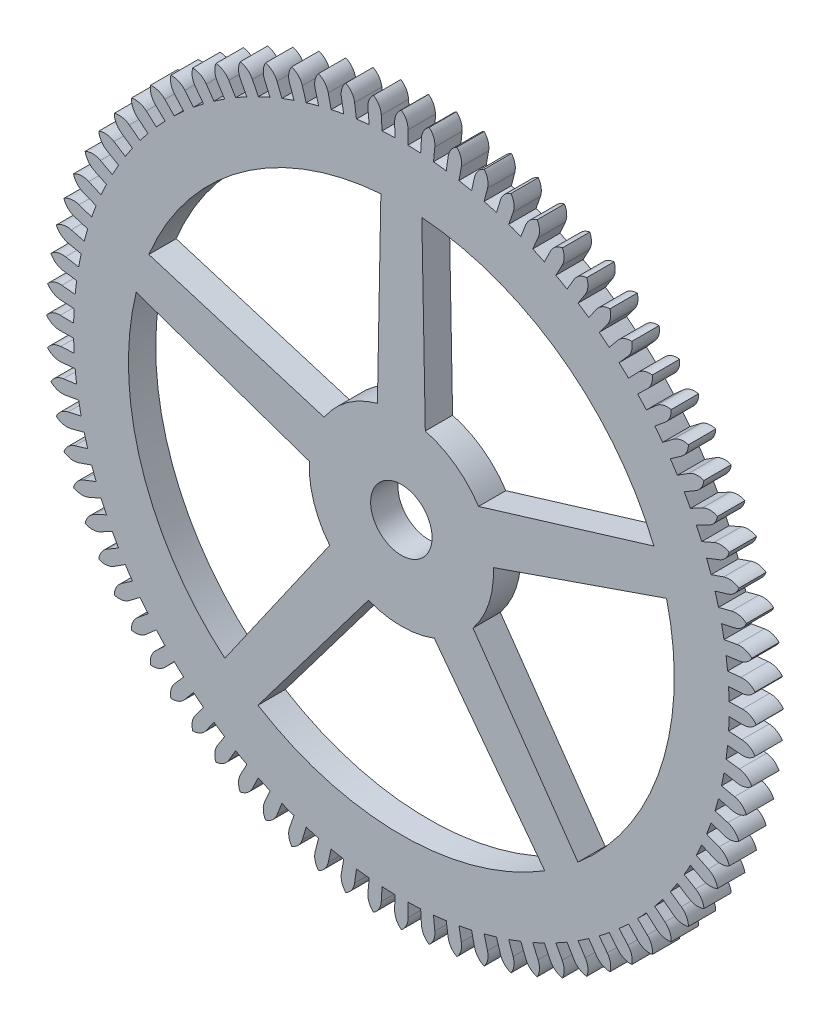
from build123d import *

# Parameters (mm, degrees)
SKETCH1_R           = 0.9
BOSS_EXTRUDE1_DEPTH = 0.8


with BuildPart() as part:
    # Sketch1 → Boss-Extrude1 (new body)
    with BuildSketch(Plane.XY):
        with BuildLine():
            ThreePointArc((0.196340537, 9.998072334), (0.146742853, 10.223513802), (0, 10.4017))
            ThreePointArc((0, 10.4017), (-0.146742853, 10.223513802), (-0.196340537, 9.998072334))
            Line((-0.196340537, 9.998072334), (-0.188630244, 9.605448033))
            ThreePointArc((-0.188630244, 9.605448033), (-0.377180828, 9.59989312), (-0.565586006, 9.590637401))
            Line((-0.565586006, 9.590637401), (-0.588704429, 9.982656315))
            ThreePointArc((-0.588704429, 9.982656315), (-0.655837154, 10.203511433), (-0.816107976, 10.36963503))
            ThreePointArc((-0.816107976, 10.36963503), (-0.948418142, 10.18048481), (-0.980174999, 9.951846913))
            Line((-0.980174999, 9.951846913), (-0.941683527, 9.561037884))
            ThreePointArc((-0.941683527, 9.561037884), (-1.129217039, 9.540706587), (-1.316315231, 9.5166973))
            Line((-1.316315231, 9.5166973), (-1.370119837, 9.9056939))
            ThreePointArc((-1.370119837, 9.9056939), (-1.454373707, 10.120601022), (-1.627184375, 10.273637812))
            ThreePointArc((-1.627184375, 10.273637812), (-1.744246118, 10.074689743), (-1.757966357, 9.844265046))
            Line((-1.757966357, 9.844265046), (-1.688931018, 9.457680757))
            ThreePointArc((-1.688931018, 9.457680757), (-1.874291251, 9.422698424), (-2.058928935, 9.384083596))
            Line((-2.058928935, 9.384083596), (-2.143088001, 9.767659588))
            ThreePointArc((-2.143088001, 9.767659588), (-2.243943563, 9.975293741), (-2.428228641, 10.114300201))
            ThreePointArc((-2.428228641, 10.114300201), (-2.529320236, 9.906780863), (-2.524919267, 9.675990011))
            Line((-2.524919267, 9.675990011), (-2.425765687, 9.296013883))
            ThreePointArc((-2.425765687, 9.296013883), (-2.607809834, 9.246596193), (-2.788848658, 9.193613895))
            Line((-2.788848658, 9.193613895), (-2.902843315, 9.569404406))
            ThreePointArc((-2.902843315, 9.569404406), (-3.01967876, 9.768485457), (-3.21430207, 9.892604566))
            ThreePointArc((-3.21430207, 9.892604566), (-3.298800254, 9.677793386), (-3.27630521, 9.448059281))
            Line((-3.27630521, 9.448059281), (-3.147644704, 9.077033993))
            ThreePointArc((-3.147644704, 9.077033993), (-3.325250402, 9.013485622), (-3.501574201, 8.946462508))
            Line((-3.501574201, 8.946462508), (-3.644701634, 9.312150665))
            ThreePointArc((-3.644701634, 9.312150665), (-3.776796634, 9.501451211), (-3.980558258, 9.609917733))
            ThreePointArc((-3.980558258, 9.609917733), (-4.047942072, 9.389139094), (-4.007491642, 9.161878123))
            Line((-4.007491642, 9.161878123), (-3.850117445, 8.802091169))
            ThreePointArc((-3.850117445, 8.802091169), (-4.022189696, 8.724803914), (-4.192711374, 8.644153204))
            Line((-4.192711374, 8.644153204), (-4.364089156, 8.997484417))
            ThreePointArc((-4.364089156, 8.997484417), (-4.510629301, 9.175837359), (-4.722272981, 9.267982563))
            ThreePointArc((-4.722272981, 9.267982563), (-4.77212698, 9.042597637), (-4.713970555, 8.81921094))
            Line((-4.713970555, 8.81921094), (-4.528852931, 8.472880527))
            ThreePointArc((-4.528852931, 8.472880527), (-4.694330853, 8.382330889), (-4.857999088, 8.288549822))
            Line((-4.857999088, 8.288549822), (-5.056570616, 8.627345687))
            ThreePointArc((-5.056570616, 8.627345687), (-5.216652438, 8.793651419), (-5.434873321, 8.868907198))
            ThreePointArc((-5.434873321, 8.868907198), (-5.466890139, 8.640305559), (-5.391386272, 8.422170389))
            Line((-5.391386272, 8.422170389), (-5.179666533, 8.091431758))
            ThreePointArc((-5.179666533, 8.091431758), (-5.3375299, 7.988178006), (-5.493335622, 7.881844773))
            Line((-5.493335622, 7.881844773), (-5.717876638, 8.204016501))
            ThreePointArc((-5.717876638, 8.204016501), (-5.890513178, 8.357249694), (-6.113965859, 8.41515207))
            ThreePointArc((-6.113965859, 8.41515207), (-6.127948102, 8.184743123), (-6.035562301, 7.973204357))
            Line((-6.035562301, 7.973204357), (-5.798545769, 7.660096622))
            ThreePointArc((-5.798545769, 7.660096622), (-5.947821299, 7.54477535), (-6.094803915, 7.426545531))
            Line((-6.094803915, 7.426545531), (-6.343930048, 7.730106826))
            ThreePointArc((-6.343930048, 7.730106826), (-6.528056945, 7.869322745), (-6.755363764, 7.909514732))
            ThreePointArc((-6.755363764, 7.909514732), (-6.751225227, 7.678719025), (-6.64252708, 7.475080868))
            Line((-6.64252708, 7.475080868), (-6.381675042, 7.181534443))
            ThreePointArc((-6.381675042, 7.181534443), (-6.521442403, 7.054856645), (-6.658695716, 6.925459166))
            Line((-6.658695716, 6.925459166), (-6.930871021, 7.208538471))
            ThreePointArc((-6.930871021, 7.208538471), (-7.125353071, 7.332878804), (-7.355112606, 7.355112606))
            ThreePointArc((-7.355112606, 7.355112606), (-7.332878804, 7.125353071), (-7.208538471, 6.930871021))
            Line((-7.208538471, 6.930871021), (-6.925459166, 6.658695716))
            ThreePointArc((-6.925459166, 6.658695716), (-7.054856645, 6.521442403), (-7.181534443, 6.381675042))
            Line((-7.181534443, 6.381675042), (-7.475080868, 6.64252708))
            ThreePointArc((-7.475080868, 6.64252708), (-7.678719025, 6.751225227), (-7.909514732, 6.755363764))
            ThreePointArc((-7.909514732, 6.755363764), (-7.869322745, 6.528056945), (-7.730106826, 6.343930048))
            Line((-7.730106826, 6.343930048), (-7.426545531, 6.094803915))
            ThreePointArc((-7.426545531, 6.094803915), (-7.54477535, 5.947821299), (-7.660096622, 5.798545769))
            Line((-7.660096622, 5.798545769), (-7.973204357, 6.035562301))
            ThreePointArc((-7.973204357, 6.035562301), (-8.184743123, 6.127948102), (-8.41515207, 6.113965859))
            ThreePointArc((-8.41515207, 6.113965859), (-8.357249694, 5.890513178), (-8.204016501, 5.717876638))
            Line((-8.204016501, 5.717876638), (-7.881844773, 5.493335622))
            ThreePointArc((-7.881844773, 5.493335622), (-7.988178006, 5.3375299), (-8.091431758, 5.179666533))
            Line((-8.091431758, 5.179666533), (-8.422170389, 5.391386272))
            ThreePointArc((-8.422170389, 5.391386272), (-8.640305559, 5.466890139), (-8.868907198, 5.434873321))
            ThreePointArc((-8.868907198, 5.434873321), (-8.793651419, 5.216652438), (-8.627345687, 5.056570616))
            Line((-8.627345687, 5.056570616), (-8.288549822, 4.857999088))
            ThreePointArc((-8.288549822, 4.857999088), (-8.382330889, 4.694330853), (-8.472880527, 4.528852931))
            Line((-8.472880527, 4.528852931), (-8.81921094, 4.713970555))
            ThreePointArc((-8.81921094, 4.713970555), (-9.042597637, 4.77212698), (-9.267982563, 4.722272981))
            ThreePointArc((-9.267982563, 4.722272981), (-9.175837359, 4.510629301), (-8.997484417, 4.364089156))
            Line((-8.997484417, 4.364089156), (-8.644153204, 4.192711374))
            ThreePointArc((-8.644153204, 4.192711374), (-8.724803914, 4.022189696), (-8.802091169, 3.850117445))
            Line((-8.802091169, 3.850117445), (-9.161878123, 4.007491642))
            ThreePointArc((-9.161878123, 4.007491642), (-9.389139094, 4.047942072), (-9.609917733, 3.980558258))
            ThreePointArc((-9.609917733, 3.980558258), (-9.501451211, 3.776796634), (-9.312150665, 3.644701634))
            Line((-9.312150665, 3.644701634), (-8.946462508, 3.501574201))
            ThreePointArc((-8.946462508, 3.501574201), (-9.013485622, 3.325250402), (-9.077033993, 3.147644704))
            Line((-9.077033993, 3.147644704), (-9.448059281, 3.27630521))
            ThreePointArc((-9.448059281, 3.27630521), (-9.677793386, 3.298800254), (-9.892604566, 3.21430207))
            ThreePointArc((-9.892604566, 3.21430207), (-9.768485457, 3.01967876), (-9.569404406, 2.902843315))
            Line((-9.569404406, 2.902843315), (-9.193613895, 2.788848658))
            ThreePointArc((-9.193613895, 2.788848658), (-9.246596193, 2.607809834), (-9.296013883, 2.425765687))
            Line((-9.296013883, 2.425765687), (-9.675990011, 2.524919267))
            ThreePointArc((-9.675990011, 2.524919267), (-9.906780863, 2.529320236), (-10.114300201, 2.428228641))
            ThreePointArc((-10.114300201, 2.428228641), (-9.975293741, 2.243943563), (-9.767659588, 2.143088001))
            Line((-9.767659588, 2.143088001), (-9.384083596, 2.058928935))
            ThreePointArc((-9.384083596, 2.058928935), (-9.422698424, 1.874291251), (-9.457680757, 1.688931018))
            Line((-9.457680757, 1.688931018), (-9.844265046, 1.757966357))
            ThreePointArc((-9.844265046, 1.757966357), (-10.074689743, 1.744246118), (-10.273637812, 1.627184375))
            ThreePointArc((-10.273637812, 1.627184375), (-10.120601022, 1.454373707), (-9.9056939, 1.370119837))
            Line((-9.9056939, 1.370119837), (-9.5166973, 1.316315231))
            ThreePointArc((-9.5166973, 1.316315231), (-9.540706587, 1.129217039), (-9.561037884, 0.941683527))
            Line((-9.561037884, 0.941683527), (-9.951846913, 0.980174999))
            ThreePointArc((-9.951846913, 0.980174999), (-10.18048481, 0.948418142), (-10.36963503, 0.816107976))
            ThreePointArc((-10.36963503, 0.816107976), (-10.203511433, 0.655837154), (-9.982656315, 0.588704429))
            Line((-9.982656315, 0.588704429), (-9.590637401, 0.565586006))
            ThreePointArc((-9.590637401, 0.565586006), (-9.59989312, 0.377180828), (-9.605448033, 0.188630244))
            Line((-9.605448033, 0.188630244), (-9.998072334, 0.196340537))
            ThreePointArc((-9.998072334, 0.196340537), (-10.223513802, 0.146742853), (-10.4017, 0))
            ThreePointArc((-10.4017, 0), (-10.223513802, -0.146742853), (-9.998072334, -0.196340537))
            Line((-9.998072334, -0.196340537), (-9.605448033, -0.188630244))
            ThreePointArc((-9.605448033, -0.188630244), (-9.59989312, -0.377180828), (-9.590637401, -0.565586006))
            Line((-9.590637401, -0.565586006), (-9.982656315, -0.588704429))
            ThreePointArc((-9.982656315, -0.588704429), (-10.203511433, -0.655837154), (-10.36963503, -0.816107976))
            ThreePointArc((-10.36963503, -0.816107976), (-10.18048481, -0.948418142), (-9.951846913, -0.980174999))
            Line((-9.951846913, -0.980174999), (-9.561037884, -0.941683527))
            ThreePointArc((-9.561037884, -0.941683527), (-9.540706587, -1.129217039), (-9.5166973, -1.316315231))
            Line((-9.5166973, -1.316315231), (-9.9056939, -1.370119837))
            ThreePointArc((-9.9056939, -1.370119837), (-10.120601022, -1.454373707), (-10.273637812, -1.627184375))
            ThreePointArc((-10.273637812, -1.627184375), (-10.074689743, -1.744246118), (-9.844265046, -1.757966357))
            Line((-9.844265046, -1.757966357), (-9.457680757, -1.688931018))
            ThreePointArc((-9.457680757, -1.688931018), (-9.422698424, -1.874291251), (-9.384083596, -2.058928935))
            Line((-9.384083596, -2.058928935), (-9.767659588, -2.143088001))
            ThreePointArc((-9.767659588, -2.143088001), (-9.975293741, -2.243943563), (-10.114300201, -2.428228641))
            ThreePointArc((-10.114300201, -2.428228641), (-9.906780863, -2.529320236), (-9.675990011, -2.524919267))
            Line((-9.675990011, -2.524919267), (-9.296013883, -2.425765687))
            ThreePointArc((-9.296013883, -2.425765687), (-9.246596193, -2.607809834), (-9.193613895, -2.788848658))
            Line((-9.193613895, -2.788848658), (-9.569404406, -2.902843315))
            ThreePointArc((-9.569404406, -2.902843315), (-9.768485457, -3.01967876), (-9.892604566, -3.21430207))
            ThreePointArc((-9.892604566, -3.21430207), (-9.677793386, -3.298800254), (-9.448059281, -3.27630521))
            Line((-9.448059281, -3.27630521), (-9.077033993, -3.147644704))
            ThreePointArc((-9.077033993, -3.147644704), (-9.013485622, -3.325250402), (-8.946462508, -3.501574201))
            Line((-8.946462508, -3.501574201), (-9.312150665, -3.644701634))
            ThreePointArc((-9.312150665, -3.644701634), (-9.501451211, -3.776796634), (-9.609917733, -3.980558258))
            ThreePointArc((-9.609917733, -3.980558258), (-9.389139094, -4.047942072), (-9.161878123, -4.007491642))
            Line((-9.161878123, -4.007491642), (-8.802091169, -3.850117445))
            ThreePointArc((-8.802091169, -3.850117445), (-8.724803914, -4.022189696), (-8.644153204, -4.192711374))
            Line((-8.644153204, -4.192711374), (-8.997484417, -4.364089156))
            ThreePointArc((-8.997484417, -4.364089156), (-9.175837359, -4.510629301), (-9.267982563, -4.722272981))
            ThreePointArc((-9.267982563, -4.722272981), (-9.042597637, -4.77212698), (-8.81921094, -4.713970555))
            Line((-8.81921094, -4.713970555), (-8.472880527, -4.528852931))
            ThreePointArc((-8.472880527, -4.528852931), (-8.382330889, -4.694330853), (-8.288549822, -4.857999088))
            Line((-8.288549822, -4.857999088), (-8.627345687, -5.056570616))
            ThreePointArc((-8.627345687, -5.056570616), (-8.793651419, -5.216652438), (-8.868907198, -5.434873321))
            ThreePointArc((-8.868907198, -5.434873321), (-8.640305559, -5.466890139), (-8.422170389, -5.391386272))
            Line((-8.422170389, -5.391386272), (-8.091431758, -5.179666533))
            ThreePointArc((-8.091431758, -5.179666533), (-7.988178006, -5.3375299), (-7.881844773, -5.493335622))
            Line((-7.881844773, -5.493335622), (-8.204016501, -5.717876638))
            ThreePointArc((-8.204016501, -5.717876638), (-8.357249694, -5.890513178), (-8.41515207, -6.113965859))
            ThreePointArc((-8.41515207, -6.113965859), (-8.184743123, -6.127948102), (-7.973204357, -6.035562301))
            Line((-7.973204357, -6.035562301), (-7.660096622, -5.798545769))
            ThreePointArc((-7.660096622, -5.798545769), (-7.54477535, -5.947821299), (-7.426545531, -6.094803915))
            Line((-7.426545531, -6.094803915), (-7.730106826, -6.343930048))
            ThreePointArc((-7.730106826, -6.343930048), (-7.869322745, -6.528056945), (-7.909514732, -6.755363764))
            ThreePointArc((-7.909514732, -6.755363764), (-7.678719025, -6.751225227), (-7.475080868, -6.64252708))
            Line((-7.475080868, -6.64252708), (-7.181534443, -6.381675042))
            ThreePointArc((-7.181534443, -6.381675042), (-7.054856645, -6.521442403), (-6.925459166, -6.658695716))
            Line((-6.925459166, -6.658695716), (-7.208538471, -6.930871021))
            ThreePointArc((-7.208538471, -6.930871021), (-7.332878804, -7.125353071), (-7.355112606, -7.355112606))
            ThreePointArc((-7.355112606, -7.355112606), (-7.125353071, -7.332878804), (-6.930871021, -7.208538471))
            Line((-6.930871021, -7.208538471), (-6.658695716, -6.925459166))
            ThreePointArc((-6.658695716, -6.925459166), (-6.521442403, -7.054856645), (-6.381675042, -7.181534443))
            Line((-6.381675042, -7.181534443), (-6.64252708, -7.475080868))
            ThreePointArc((-6.64252708, -7.475080868), (-6.751225227, -7.678719025), (-6.755363764, -7.909514732))
            ThreePointArc((-6.755363764, -7.909514732), (-6.528056945, -7.869322745), (-6.343930048, -7.730106826))
            Line((-6.343930048, -7.730106826), (-6.094803915, -7.426545531))
            ThreePointArc((-6.094803915, -7.426545531), (-5.947821299, -7.54477535), (-5.798545769, -7.660096622))
            Line((-5.798545769, -7.660096622), (-6.035562301, -7.973204357))
            ThreePointArc((-6.035562301, -7.973204357), (-6.127948102, -8.184743123), (-6.113965859, -8.41515207))
            ThreePointArc((-6.113965859, -8.41515207), (-5.890513178, -8.357249694), (-5.717876638, -8.204016501))
            Line((-5.717876638, -8.204016501), (-5.493335622, -7.881844773))
            ThreePointArc((-5.493335622, -7.881844773), (-5.3375299, -7.988178006), (-5.179666533, -8.091431758))
            Line((-5.179666533, -8.091431758), (-5.391386272, -8.422170389))
            ThreePointArc((-5.391386272, -8.422170389), (-5.466890139, -8.640305559), (-5.434873321, -8.868907198))
            ThreePointArc((-5.434873321, -8.868907198), (-5.216652438, -8.793651419), (-5.056570616, -8.627345687))
            Line((-5.056570616, -8.627345687), (-4.857999088, -8.288549822))
            ThreePointArc((-4.857999088, -8.288549822), (-4.694330853, -8.382330889), (-4.528852931, -8.472880527))
            Line((-4.528852931, -8.472880527), (-4.713970555, -8.81921094))
            ThreePointArc((-4.713970555, -8.81921094), (-4.77212698, -9.042597637), (-4.722272981, -9.267982563))
            ThreePointArc((-4.722272981, -9.267982563), (-4.510629301, -9.175837359), (-4.364089156, -8.997484417))
            Line((-4.364089156, -8.997484417), (-4.192711374, -8.644153204))
            ThreePointArc((-4.192711374, -8.644153204), (-4.022189696, -8.724803914), (-3.850117445, -8.802091169))
            Line((-3.850117445, -8.802091169), (-4.007491642, -9.161878123))
            ThreePointArc((-4.007491642, -9.161878123), (-4.047942072, -9.389139094), (-3.980558258, -9.609917733))
            ThreePointArc((-3.980558258, -9.609917733), (-3.776796634, -9.501451211), (-3.644701634, -9.312150665))
            Line((-3.644701634, -9.312150665), (-3.501574201, -8.946462508))
            ThreePointArc((-3.501574201, -8.946462508), (-3.325250402, -9.013485622), (-3.147644704, -9.077033993))
            Line((-3.147644704, -9.077033993), (-3.27630521, -9.448059281))
            ThreePointArc((-3.27630521, -9.448059281), (-3.298800254, -9.677793386), (-3.21430207, -9.892604566))
            ThreePointArc((-3.21430207, -9.892604566), (-3.01967876, -9.768485457), (-2.902843315, -9.569404406))
            Line((-2.902843315, -9.569404406), (-2.788848658, -9.193613895))
            ThreePointArc((-2.788848658, -9.193613895), (-2.607809834, -9.246596193), (-2.425765687, -9.296013883))
            Line((-2.425765687, -9.296013883), (-2.524919267, -9.675990011))
            ThreePointArc((-2.524919267, -9.675990011), (-2.529320236, -9.906780863), (-2.428228641, -10.114300201))
            ThreePointArc((-2.428228641, -10.114300201), (-2.243943563, -9.975293741), (-2.143088001, -9.767659588))
            Line((-2.143088001, -9.767659588), (-2.058928935, -9.384083596))
            ThreePointArc((-2.058928935, -9.384083596), (-1.874291251, -9.422698424), (-1.688931018, -9.457680757))
            Line((-1.688931018, -9.457680757), (-1.757966357, -9.844265046))
            ThreePointArc((-1.757966357, -9.844265046), (-1.744246118, -10.074689743), (-1.627184375, -10.273637812))
            ThreePointArc((-1.627184375, -10.273637812), (-1.454373707, -10.120601022), (-1.370119837, -9.9056939))
            Line((-1.370119837, -9.9056939), (-1.316315231, -9.5166973))
            ThreePointArc((-1.316315231, -9.5166973), (-1.129217039, -9.540706587), (-0.941683527, -9.561037884))
            Line((-0.941683527, -9.561037884), (-0.980174999, -9.951846913))
            ThreePointArc((-0.980174999, -9.951846913), (-0.948418142, -10.18048481), (-0.816107976, -10.36963503))
            ThreePointArc((-0.816107976, -10.36963503), (-0.655837154, -10.203511433), (-0.588704429, -9.982656315))
            Line((-0.588704429, -9.982656315), (-0.565586006, -9.590637401))
            ThreePointArc((-0.565586006, -9.590637401), (-0.377180828, -9.59989312), (-0.188630244, -9.605448033))
            Line((-0.188630244, -9.605448033), (-0.196340537, -9.998072334))
            ThreePointArc((-0.196340537, -9.998072334), (-0.146742853, -10.223513802), (0, -10.4017))
            ThreePointArc((0, -10.4017), (0.146742853, -10.223513802), (0.196340537, -9.998072334))
            Line((0.196340537, -9.998072334), (0.188630244, -9.605448033))
            ThreePointArc((0.188630244, -9.605448033), (0.377180828, -9.59989312), (0.565586006, -9.590637401))
            Line((0.565586006, -9.590637401), (0.588704429, -9.982656315))
            ThreePointArc((0.588704429, -9.982656315), (0.655837154, -10.203511433), (0.816107976, -10.36963503))
            ThreePointArc((0.816107976, -10.36963503), (0.948418142, -10.18048481), (0.980174999, -9.951846913))
            Line((0.980174999, -9.951846913), (0.941683527, -9.561037884))
            ThreePointArc((0.941683527, -9.561037884), (1.129217039, -9.540706587), (1.316315231, -9.5166973))
            Line((1.316315231, -9.5166973), (1.370119837, -9.9056939))
            ThreePointArc((1.370119837, -9.9056939), (1.454373707, -10.120601022), (1.627184375, -10.273637812))
            ThreePointArc((1.627184375, -10.273637812), (1.744246118, -10.074689743), (1.757966357, -9.844265046))
            Line((1.757966357, -9.844265046), (1.688931018, -9.457680757))
            ThreePointArc((1.688931018, -9.457680757), (1.874291251, -9.422698424), (2.058928935, -9.384083596))
            Line((2.058928935, -9.384083596), (2.143088001, -9.767659588))
            ThreePointArc((2.143088001, -9.767659588), (2.243943563, -9.975293741), (2.428228641, -10.114300201))
            ThreePointArc((2.428228641, -10.114300201), (2.529320236, -9.906780863), (2.524919267, -9.675990011))
            Line((2.524919267, -9.675990011), (2.425765687, -9.296013883))
            ThreePointArc((2.425765687, -9.296013883), (2.607809834, -9.246596193), (2.788848658, -9.193613895))
            Line((2.788848658, -9.193613895), (2.902843315, -9.569404406))
            ThreePointArc((2.902843315, -9.569404406), (3.01967876, -9.768485457), (3.21430207, -9.892604566))
            ThreePointArc((3.21430207, -9.892604566), (3.298800254, -9.677793386), (3.27630521, -9.448059281))
            Line((3.27630521, -9.448059281), (3.147644704, -9.077033993))
            ThreePointArc((3.147644704, -9.077033993), (3.325250402, -9.013485622), (3.501574201, -8.946462508))
            Line((3.501574201, -8.946462508), (3.644701634, -9.312150665))
            ThreePointArc((3.644701634, -9.312150665), (3.776796634, -9.501451211), (3.980558258, -9.609917733))
            ThreePointArc((3.980558258, -9.609917733), (4.047942072, -9.389139094), (4.007491642, -9.161878123))
            Line((4.007491642, -9.161878123), (3.850117445, -8.802091169))
            ThreePointArc((3.850117445, -8.802091169), (4.022189696, -8.724803914), (4.192711374, -8.644153204))
            Line((4.192711374, -8.644153204), (4.364089156, -8.997484417))
            ThreePointArc((4.364089156, -8.997484417), (4.510629301, -9.175837359), (4.722272981, -9.267982563))
            ThreePointArc((4.722272981, -9.267982563), (4.77212698, -9.042597637), (4.713970555, -8.81921094))
            Line((4.713970555, -8.81921094), (4.528852931, -8.472880527))
            ThreePointArc((4.528852931, -8.472880527), (4.694330853, -8.382330889), (4.857999088, -8.288549822))
            Line((4.857999088, -8.288549822), (5.056570616, -8.627345687))
            ThreePointArc((5.056570616, -8.627345687), (5.216652438, -8.793651419), (5.434873321, -8.868907198))
            ThreePointArc((5.434873321, -8.868907198), (5.466890139, -8.640305559), (5.391386272, -8.422170389))
            Line((5.391386272, -8.422170389), (5.179666533, -8.091431758))
            ThreePointArc((5.179666533, -8.091431758), (5.3375299, -7.988178006), (5.493335622, -7.881844773))
            Line((5.493335622, -7.881844773), (5.717876638, -8.204016501))
            ThreePointArc((5.717876638, -8.204016501), (5.890513178, -8.357249694), (6.113965859, -8.41515207))
            ThreePointArc((6.113965859, -8.41515207), (6.127948102, -8.184743123), (6.035562301, -7.973204357))
            Line((6.035562301, -7.973204357), (5.798545769, -7.660096622))
            ThreePointArc((5.798545769, -7.660096622), (5.947821299, -7.54477535), (6.094803915, -7.426545531))
            Line((6.094803915, -7.426545531), (6.343930048, -7.730106826))
            ThreePointArc((6.343930048, -7.730106826), (6.528056945, -7.869322745), (6.755363764, -7.909514732))
            ThreePointArc((6.755363764, -7.909514732), (6.751225227, -7.678719025), (6.64252708, -7.475080868))
            Line((6.64252708, -7.475080868), (6.381675042, -7.181534443))
            ThreePointArc((6.381675042, -7.181534443), (6.521442403, -7.054856645), (6.658695716, -6.925459166))
            Line((6.658695716, -6.925459166), (6.930871021, -7.208538471))
            ThreePointArc((6.930871021, -7.208538471), (7.125353071, -7.332878804), (7.355112606, -7.355112606))
            ThreePointArc((7.355112606, -7.355112606), (7.332878804, -7.125353071), (7.208538471, -6.930871021))
            Line((7.208538471, -6.930871021), (6.925459166, -6.658695716))
            ThreePointArc((6.925459166, -6.658695716), (7.054856645, -6.521442403), (7.181534443, -6.381675042))
            Line((7.181534443, -6.381675042), (7.475080868, -6.64252708))
            ThreePointArc((7.475080868, -6.64252708), (7.678719025, -6.751225227), (7.909514732, -6.755363764))
            ThreePointArc((7.909514732, -6.755363764), (7.869322745, -6.528056945), (7.730106826, -6.343930048))
            Line((7.730106826, -6.343930048), (7.426545531, -6.094803915))
            ThreePointArc((7.426545531, -6.094803915), (7.54477535, -5.947821299), (7.660096622, -5.798545769))
            Line((7.660096622, -5.798545769), (7.973204357, -6.035562301))
            ThreePointArc((7.973204357, -6.035562301), (8.184743123, -6.127948102), (8.41515207, -6.113965859))
            ThreePointArc((8.41515207, -6.113965859), (8.357249694, -5.890513178), (8.204016501, -5.717876638))
            Line((8.204016501, -5.717876638), (7.881844773, -5.493335622))
            ThreePointArc((7.881844773, -5.493335622), (7.988178006, -5.3375299), (8.091431758, -5.179666533))
            Line((8.091431758, -5.179666533), (8.422170389, -5.391386272))
            ThreePointArc((8.422170389, -5.391386272), (8.640305559, -5.466890139), (8.868907198, -5.434873321))
            ThreePointArc((8.868907198, -5.434873321), (8.793651419, -5.216652438), (8.627345687, -5.056570616))
            Line((8.627345687, -5.056570616), (8.288549822, -4.857999088))
            ThreePointArc((8.288549822, -4.857999088), (8.382330889, -4.694330853), (8.472880527, -4.528852931))
            Line((8.472880527, -4.528852931), (8.81921094, -4.713970555))
            ThreePointArc((8.81921094, -4.713970555), (9.042597637, -4.77212698), (9.267982563, -4.722272981))
            ThreePointArc((9.267982563, -4.722272981), (9.175837359, -4.510629301), (8.997484417, -4.364089156))
            Line((8.997484417, -4.364089156), (8.644153204, -4.192711374))
            ThreePointArc((8.644153204, -4.192711374), (8.724803914, -4.022189696), (8.802091169, -3.850117445))
            Line((8.802091169, -3.850117445), (9.161878123, -4.007491642))
            ThreePointArc((9.161878123, -4.007491642), (9.389139094, -4.047942072), (9.609917733, -3.980558258))
            ThreePointArc((9.609917733, -3.980558258), (9.501451211, -3.776796634), (9.312150665, -3.644701634))
            Line((9.312150665, -3.644701634), (8.946462508, -3.501574201))
            ThreePointArc((8.946462508, -3.501574201), (9.013485622, -3.325250402), (9.077033993, -3.147644704))
            Line((9.077033993, -3.147644704), (9.448059281, -3.27630521))
            ThreePointArc((9.448059281, -3.27630521), (9.677793386, -3.298800254), (9.892604566, -3.21430207))
            ThreePointArc((9.892604566, -3.21430207), (9.768485457, -3.01967876), (9.569404406, -2.902843315))
            Line((9.569404406, -2.902843315), (9.193613895, -2.788848658))
            ThreePointArc((9.193613895, -2.788848658), (9.246596193, -2.607809834), (9.296013883, -2.425765687))
            Line((9.296013883, -2.425765687), (9.675990011, -2.524919267))
            ThreePointArc((9.675990011, -2.524919267), (9.906780863, -2.529320236), (10.114300201, -2.428228641))
            ThreePointArc((10.114300201, -2.428228641), (9.975293741, -2.243943563), (9.767659588, -2.143088001))
            Line((9.767659588, -2.143088001), (9.384083596, -2.058928935))
            ThreePointArc((9.384083596, -2.058928935), (9.422698424, -1.874291251), (9.457680757, -1.688931018))
            Line((9.457680757, -1.688931018), (9.844265046, -1.757966357))
            ThreePointArc((9.844265046, -1.757966357), (10.074689743, -1.744246118), (10.273637812, -1.627184375))
            ThreePointArc((10.273637812, -1.627184375), (10.120601022, -1.454373707), (9.9056939, -1.370119837))
            Line((9.9056939, -1.370119837), (9.5166973, -1.316315231))
            ThreePointArc((9.5166973, -1.316315231), (9.540706587, -1.129217039), (9.561037884, -0.941683527))
            Line((9.561037884, -0.941683527), (9.951846913, -0.980174999))
            ThreePointArc((9.951846913, -0.980174999), (10.18048481, -0.948418142), (10.36963503, -0.816107976))
            ThreePointArc((10.36963503, -0.816107976), (10.203511433, -0.655837154), (9.982656315, -0.588704429))
            Line((9.982656315, -0.588704429), (9.590637401, -0.565586006))
            ThreePointArc((9.590637401, -0.565586006), (9.59989312, -0.377180828), (9.605448033, -0.188630244))
            Line((9.605448033, -0.188630244), (9.998072334, -0.196340537))
            ThreePointArc((9.998072334, -0.196340537), (10.223513802, -0.146742853), (10.4017, 0))
            ThreePointArc((10.4017, 0), (10.223513802, 0.146742853), (9.998072334, 0.196340537))
            Line((9.998072334, 0.196340537), (9.605448033, 0.188630244))
            ThreePointArc((9.605448033, 0.188630244), (9.59989312, 0.377180828), (9.590637401, 0.565586006))
            Line((9.590637401, 0.565586006), (9.982656315, 0.588704429))
            ThreePointArc((9.982656315, 0.588704429), (10.203511433, 0.655837154), (10.36963503, 0.816107976))
            ThreePointArc((10.36963503, 0.816107976), (10.18048481, 0.948418142), (9.951846913, 0.980174999))
            Line((9.951846913, 0.980174999), (9.561037884, 0.941683527))
            ThreePointArc((9.561037884, 0.941683527), (9.540706587, 1.129217039), (9.5166973, 1.316315231))
            Line((9.5166973, 1.316315231), (9.9056939, 1.370119837))
            ThreePointArc((9.9056939, 1.370119837), (10.120601022, 1.454373707), (10.273637812, 1.627184375))
            ThreePointArc((10.273637812, 1.627184375), (10.074689743, 1.744246118), (9.844265046, 1.757966357))
            Line((9.844265046, 1.757966357), (9.457680757, 1.688931018))
            ThreePointArc((9.457680757, 1.688931018), (9.422698424, 1.874291251), (9.384083596, 2.058928935))
            Line((9.384083596, 2.058928935), (9.767659588, 2.143088001))
            ThreePointArc((9.767659588, 2.143088001), (9.975293741, 2.243943563), (10.114300201, 2.428228641))
            ThreePointArc((10.114300201, 2.428228641), (9.906780863, 2.529320236), (9.675990011, 2.524919267))
            Line((9.675990011, 2.524919267), (9.296013883, 2.425765687))
            ThreePointArc((9.296013883, 2.425765687), (9.246596193, 2.607809834), (9.193613895, 2.788848658))
            Line((9.193613895, 2.788848658), (9.569404406, 2.902843315))
            ThreePointArc((9.569404406, 2.902843315), (9.768485457, 3.01967876), (9.892604566, 3.21430207))
            ThreePointArc((9.892604566, 3.21430207), (9.677793386, 3.298800254), (9.448059281, 3.27630521))
            Line((9.448059281, 3.27630521), (9.077033993, 3.147644704))
            ThreePointArc((9.077033993, 3.147644704), (9.013485622, 3.325250402), (8.946462508, 3.501574201))
            Line((8.946462508, 3.501574201), (9.312150665, 3.644701634))
            ThreePointArc((9.312150665, 3.644701634), (9.501451211, 3.776796634), (9.609917733, 3.980558258))
            ThreePointArc((9.609917733, 3.980558258), (9.389139094, 4.047942072), (9.161878123, 4.007491642))
            Line((9.161878123, 4.007491642), (8.802091169, 3.850117445))
            ThreePointArc((8.802091169, 3.850117445), (8.724803914, 4.022189696), (8.644153204, 4.192711374))
            Line((8.644153204, 4.192711374), (8.997484417, 4.364089156))
            ThreePointArc((8.997484417, 4.364089156), (9.175837359, 4.510629301), (9.267982563, 4.722272981))
            ThreePointArc((9.267982563, 4.722272981), (9.042597637, 4.77212698), (8.81921094, 4.713970555))
            Line((8.81921094, 4.713970555), (8.472880527, 4.528852931))
            ThreePointArc((8.472880527, 4.528852931), (8.382330889, 4.694330853), (8.288549822, 4.857999088))
            Line((8.288549822, 4.857999088), (8.627345687, 5.056570616))
            ThreePointArc((8.627345687, 5.056570616), (8.793651419, 5.216652438), (8.868907198, 5.434873321))
            ThreePointArc((8.868907198, 5.434873321), (8.640305559, 5.466890139), (8.422170389, 5.391386272))
            Line((8.422170389, 5.391386272), (8.091431758, 5.179666533))
            ThreePointArc((8.091431758, 5.179666533), (7.988178006, 5.3375299), (7.881844773, 5.493335622))
            Line((7.881844773, 5.493335622), (8.204016501, 5.717876638))
            ThreePointArc((8.204016501, 5.717876638), (8.357249694, 5.890513178), (8.41515207, 6.113965859))
            ThreePointArc((8.41515207, 6.113965859), (8.184743123, 6.127948102), (7.973204357, 6.035562301))
            Line((7.973204357, 6.035562301), (7.660096622, 5.798545769))
            ThreePointArc((7.660096622, 5.798545769), (7.54477535, 5.947821299), (7.426545531, 6.094803915))
            Line((7.426545531, 6.094803915), (7.730106826, 6.343930048))
            ThreePointArc((7.730106826, 6.343930048), (7.869322745, 6.528056945), (7.909514732, 6.755363764))
            ThreePointArc((7.909514732, 6.755363764), (7.678719025, 6.751225227), (7.475080868, 6.64252708))
            Line((7.475080868, 6.64252708), (7.181534443, 6.381675042))
            ThreePointArc((7.181534443, 6.381675042), (7.054856645, 6.521442403), (6.925459166, 6.658695716))
            Line((6.925459166, 6.658695716), (7.208538471, 6.930871021))
            ThreePointArc((7.208538471, 6.930871021), (7.332878804, 7.125353071), (7.355112606, 7.355112606))
            ThreePointArc((7.355112606, 7.355112606), (7.125353071, 7.332878804), (6.930871021, 7.208538471))
            Line((6.930871021, 7.208538471), (6.658695716, 6.925459166))
            ThreePointArc((6.658695716, 6.925459166), (6.521442403, 7.054856645), (6.381675042, 7.181534443))
            Line((6.381675042, 7.181534443), (6.64252708, 7.475080868))
            ThreePointArc((6.64252708, 7.475080868), (6.751225227, 7.678719025), (6.755363764, 7.909514732))
            ThreePointArc((6.755363764, 7.909514732), (6.528056945, 7.869322745), (6.343930048, 7.730106826))
            Line((6.343930048, 7.730106826), (6.094803915, 7.426545531))
            ThreePointArc((6.094803915, 7.426545531), (5.947821299, 7.54477535), (5.798545769, 7.660096622))
            Line((5.798545769, 7.660096622), (6.035562301, 7.973204357))
            ThreePointArc((6.035562301, 7.973204357), (6.127948102, 8.184743123), (6.113965859, 8.41515207))
            ThreePointArc((6.113965859, 8.41515207), (5.890513178, 8.357249694), (5.717876638, 8.204016501))
            Line((5.717876638, 8.204016501), (5.493335622, 7.881844773))
            ThreePointArc((5.493335622, 7.881844773), (5.3375299, 7.988178006), (5.179666533, 8.091431758))
            Line((5.179666533, 8.091431758), (5.391386272, 8.422170389))
            ThreePointArc((5.391386272, 8.422170389), (5.466890139, 8.640305559), (5.434873321, 8.868907198))
            ThreePointArc((5.434873321, 8.868907198), (5.216652438, 8.793651419), (5.056570616, 8.627345687))
            Line((5.056570616, 8.627345687), (4.857999088, 8.288549822))
            ThreePointArc((4.857999088, 8.288549822), (4.694330853, 8.382330889), (4.528852931, 8.472880527))
            Line((4.528852931, 8.472880527), (4.713970555, 8.81921094))
            ThreePointArc((4.713970555, 8.81921094), (4.77212698, 9.042597637), (4.722272981, 9.267982563))
            ThreePointArc((4.722272981, 9.267982563), (4.510629301, 9.175837359), (4.364089156, 8.997484417))
            Line((4.364089156, 8.997484417), (4.192711374, 8.644153204))
            ThreePointArc((4.192711374, 8.644153204), (4.022189696, 8.724803914), (3.850117445, 8.802091169))
            Line((3.850117445, 8.802091169), (4.007491642, 9.161878123))
            ThreePointArc((4.007491642, 9.161878123), (4.047942072, 9.389139094), (3.980558258, 9.609917733))
            ThreePointArc((3.980558258, 9.609917733), (3.776796634, 9.501451211), (3.644701634, 9.312150665))
            Line((3.644701634, 9.312150665), (3.501574201, 8.946462508))
            ThreePointArc((3.501574201, 8.946462508), (3.325250402, 9.013485622), (3.147644704, 9.077033993))
            Line((3.147644704, 9.077033993), (3.27630521, 9.448059281))
            ThreePointArc((3.27630521, 9.448059281), (3.298800254, 9.677793386), (3.21430207, 9.892604566))
            ThreePointArc((3.21430207, 9.892604566), (3.01967876, 9.768485457), (2.902843315, 9.569404406))
            Line((2.902843315, 9.569404406), (2.788848658, 9.193613895))
            ThreePointArc((2.788848658, 9.193613895), (2.607809834, 9.246596193), (2.425765687, 9.296013883))
            Line((2.425765687, 9.296013883), (2.524919267, 9.675990011))
            ThreePointArc((2.524919267, 9.675990011), (2.529320236, 9.906780863), (2.428228641, 10.114300201))
            ThreePointArc((2.428228641, 10.114300201), (2.243943563, 9.975293741), (2.143088001, 9.767659588))
            Line((2.143088001, 9.767659588), (2.058928935, 9.384083596))
            ThreePointArc((2.058928935, 9.384083596), (1.874291251, 9.422698424), (1.688931018, 9.457680757))
            Line((1.688931018, 9.457680757), (1.757966357, 9.844265046))
            ThreePointArc((1.757966357, 9.844265046), (1.744246118, 10.074689743), (1.627184375, 10.273637812))
            ThreePointArc((1.627184375, 10.273637812), (1.454373707, 10.120601022), (1.370119837, 9.9056939))
            Line((1.370119837, 9.9056939), (1.316315231, 9.5166973))
            ThreePointArc((1.316315231, 9.5166973), (1.129217039, 9.540706587), (0.941683527, 9.561037884))
            Line((0.941683527, 9.561037884), (0.980174999, 9.951846913))
            ThreePointArc((0.980174999, 9.951846913), (0.948418142, 10.18048481), (0.816107976, 10.36963503))
            ThreePointArc((0.816107976, 10.36963503), (0.655837154, 10.203511433), (0.588704429, 9.982656315))
            Line((0.588704429, 9.982656315), (0.565586006, 9.590637401))
            ThreePointArc((0.565586006, 9.590637401), (0.377180828, 9.59989312), (0.188630244, 9.605448033))
            Line((0.188630244, 9.605448033), (0.196340537, 9.998072334))
        make_face()
        with BuildLine():
            ThreePointArc((2.2627515, 1.473076932), (1.587020181, 2.184345885), (0.701750748, 2.607210365))
            Line((0.701750748, 2.607210365), (0.600425731, 7.977436239))
            ThreePointArc((0.600425731, 7.977436239), (4.702282018, 6.472135955), (7.401450963, 3.036202174))
            Line((7.401450963, 3.036202174), (2.2627515, 1.473076932))
        make_face(mode=Mode.SUBTRACT)
        with BuildLine():
            Line((2.696457314, 0.138267689), (7.772534473, 1.894124565))
            ThreePointArc((7.772534473, 1.894124565), (7.60845213, -2.472135955), (5.174773993, -6.100960099))
            Line((5.174773993, -6.100960099), (2.100208083, -1.696798753))
            ThreePointArc((2.100208083, -1.696798753), (2.567852594, -0.834345885), (2.696457314, 0.138267689))
        make_face(mode=Mode.SUBTRACT)
        with BuildLine():
            ThreePointArc((-0.964751521, -2.521756234), (0, -2.7), (0.964751521, -2.521756234))
            Line((0.964751521, -2.521756234), (4.203264752, -6.806802879))
            ThreePointArc((4.203264752, -6.806802879), (0, -8), (-4.203264752, -6.806802879))
            Line((-4.203264752, -6.806802879), (-0.964751521, -2.521756234))
        make_face(mode=Mode.SUBTRACT)
        with BuildLine():
            ThreePointArc((-2.696457314, 0.138267689), (-2.567852594, -0.834345885), (-2.100208083, -1.696798753))
            Line((-2.100208083, -1.696798753), (-5.174773993, -6.100960099))
            ThreePointArc((-5.174773993, -6.100960099), (-7.60845213, -2.472135955), (-7.772534473, 1.894124565))
            Line((-7.772534473, 1.894124565), (-2.696457314, 0.138267689))
        make_face(mode=Mode.SUBTRACT)
        with BuildLine():
            ThreePointArc((-0.701750748, 2.607210365), (-1.587020181, 2.184345885), (-2.2627515, 1.473076932))
            Line((-2.2627515, 1.473076932), (-7.401450963, 3.036202174))
            ThreePointArc((-7.401450963, 3.036202174), (-4.702282018, 6.472135955), (-0.600425731, 7.977436239))
            Line((-0.600425731, 7.977436239), (-0.701750748, 2.607210365))
        make_face(mode=Mode.SUBTRACT)
        Circle(SKETCH1_R, mode=Mode.SUBTRACT)
    extrude(amount=BOSS_EXTRUDE1_DEPTH)


solid = part.part
